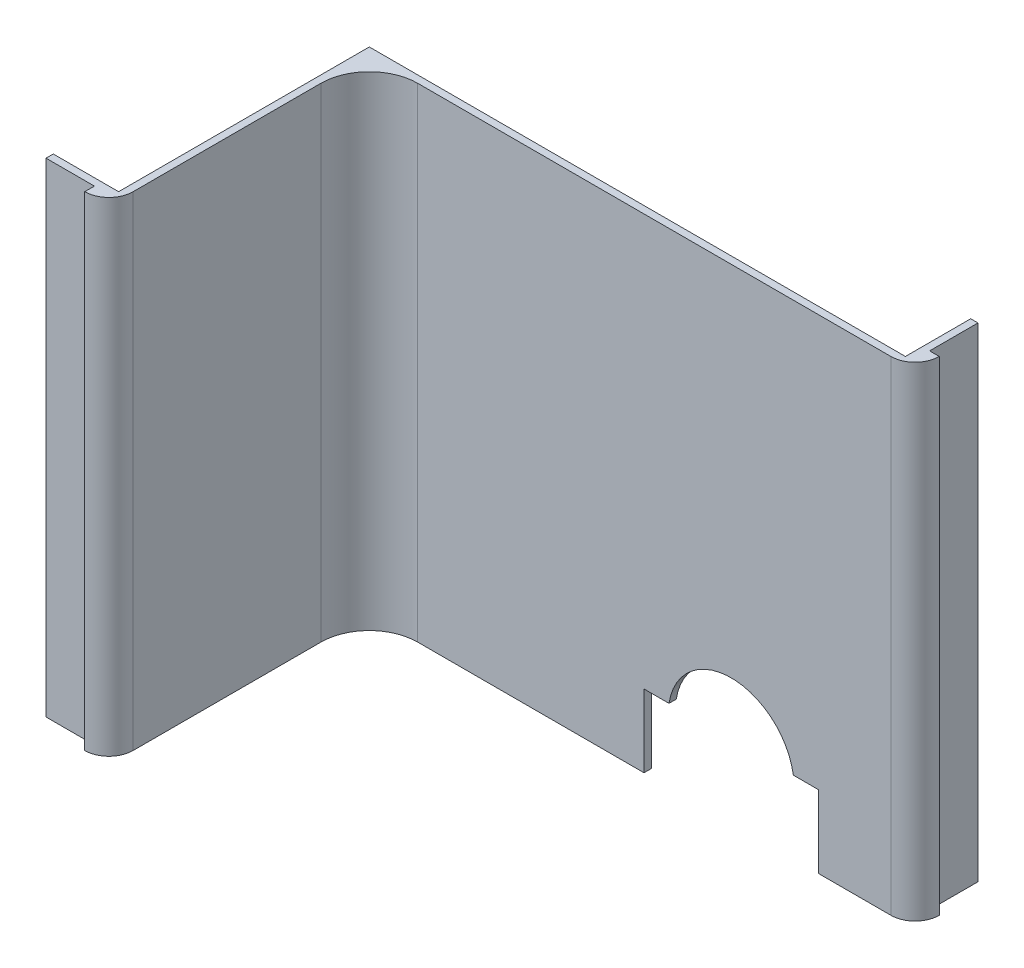
from build123d import *

# Parameters (mm, degrees)
EXTRUDE_1_DEPTH     = 100
CUT_EXTRUDE_1_DEPTH = 168.231641217


with BuildPart() as part:
    # Эскиз1 → Бобышка-Вытянуть1 (new body)
    with BuildSketch(Plane(origin=(0, 0, 0), x_dir=(1, 0, 0), z_dir=(0, 1, 0))):
        with BuildLine():
            Line((0, 0), (-97.768, 0))
            ThreePointArc((-97.768, 0), (-104.839067812, -2.928932188), (-107.768, -10))
            Line((-107.768, -10), (-107.768, -48.8))
            ThreePointArc((-107.768, -48.8), (-109.232466094, -52.335533906), (-112.768, -53.8))
            Line((-112.768, -53.8), (-112.768, -51.8))
            Line((-112.768, -51.8), (-122.768, -51.8))
            Line((-122.768, -51.8), (-122.768, -50.3))
            Line((-122.768, -50.3), (-109.268, -50.3))
            Line((-109.268, -50.3), (-109.268, 1.5))
            Line((-109.268, 1.5), (1.5, 1.5))
            Line((1.5, 1.5), (1.5, 15))
            Line((1.5, 15), (3, 15))
            Line((3, 15), (3, 5))
            Line((3, 5), (5, 5))
            ThreePointArc((5, 5), (3.535533906, 1.464466094), (0, 0))
        make_face()
    extrude(amount=EXTRUDE_1_DEPTH)

    # Эскиз4 → Вырез-Вытянуть1 (cut, through all)
    with BuildSketch(Plane.XY):
        with BuildLine():
            Line((-15, 0), (-51, 0))
            Line((-51, 0), (-51, 15))
            Line((-51, 15), (-45.845232579, 15))
            ThreePointArc((-45.845232579, 15), (-32.998579553, 25.999999922), (-20.154330668, 14.997192881))
            Line((-20.154330668, 14.997192881), (-15, 14.997192881))
            Line((-15, 14.997192881), (-15, 0))
        make_face()
    extrude(amount=-CUT_EXTRUDE_1_DEPTH, mode=Mode.SUBTRACT)


solid = part.part
